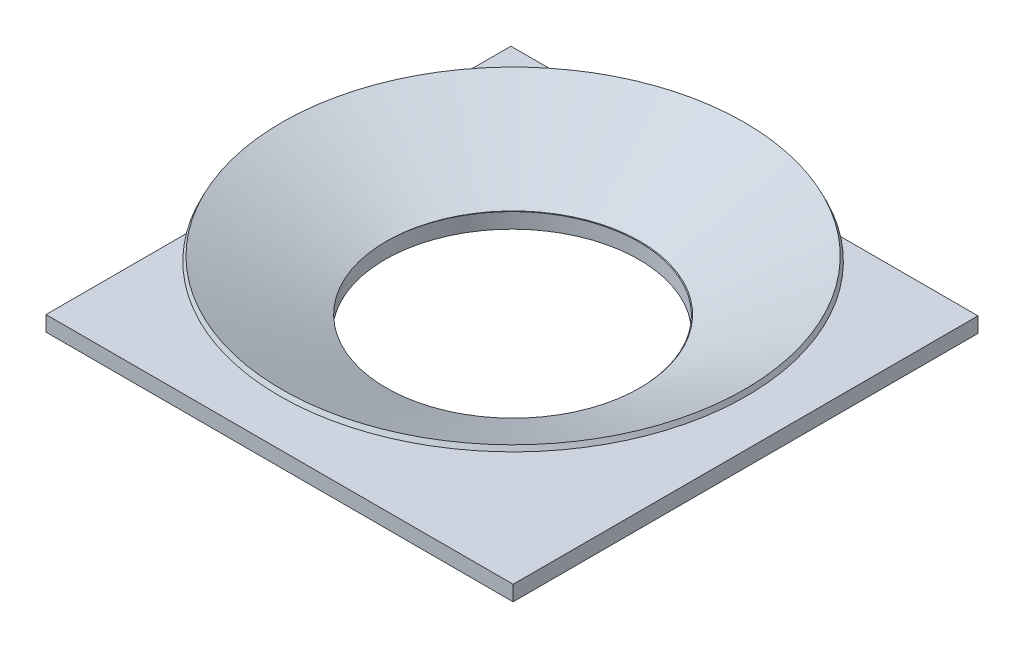
from build123d import *

# Parameters (mm, degrees)
SKETCH2_W           = 92
SKETCH2_H           = 91.562656452
SKETCH2_R           = 25
BOSS_EXTRUDE1_DEPTH = 3


with BuildPart() as part:
    # Sketch1 → Revolve1 (revolve)
    with BuildSketch(Plane.XY):
        Polygon((-27.28653196, 0), (-46, 9.100705487), (-45.562656452, 10), (-25, 0), align=None)
    revolve(axis=Axis((0, 0, 0), (0, 1, 0)))


with BuildPart() as body_2:
    # Sketch2 → Boss-Extrude1 (new body)
    with BuildSketch(Plane(origin=(0, 0, 0), x_dir=(1, 0, 0), z_dir=(0, 1, 0))):
        with Locations((0, -0.218671774)):
            Rectangle(SKETCH2_W, SKETCH2_H)
        with Locations((0, -0.218671774)):
            Circle(SKETCH2_R, mode=Mode.SUBTRACT)
    extrude(amount=-BOSS_EXTRUDE1_DEPTH)


solid = Compound([part.part, body_2.part])
